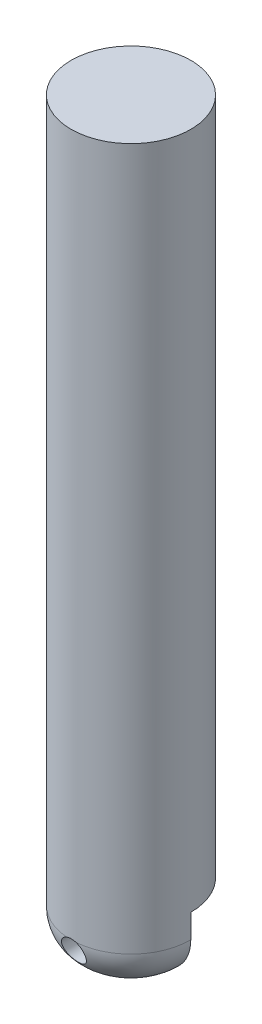
from build123d import *
from build123d.topology import SkipClean

# Parameters (mm, degrees)
SKETCH2_R           = 15
BOSS_EXTRUDE1_DEPTH = 170
BOSS_EXTRUDE2_START = 15.982197964
BOSS_EXTRUDE2_DEPTH = 15.982197964
SKETCH5_R           = 3
CUT_EXTRUDE1_DEPTH  = 19
FILLET5_R           = 10


with BuildPart() as part:
    # Sketch2 → Boss-Extrude1 (new body)
    with BuildSketch(Plane(origin=(0, 0, 0), x_dir=(1, 0, 0), z_dir=(0, 1, 0))):
        with Locations(Location((0, 0, 0), (0, 0, 270))):
            Circle(SKETCH2_R)
    extrude(amount=BOSS_EXTRUDE1_DEPTH)

    # Sketch3 → Boss-Extrude2 (add)
    with SkipClean():  # the faces are left unmerged after this step: merging them gives an invalid solid
        with BuildSketch(Plane.XZ.offset(BOSS_EXTRUDE2_START)):
            with BuildLine():
                Line((-15, 0), (15, 0))
                ThreePointArc((15, 0), (0, 15), (-15, 0))
            make_face()
        extrude(amount=-BOSS_EXTRUDE2_DEPTH)

    # Sketch5 → Cut-Extrude1 (cut)
    with SkipClean():  # the faces are left unmerged after this step: merging them gives an invalid solid
        with BuildSketch(Plane(origin=(0, 0, 0), x_dir=(-1, 0, 0), z_dir=(0, 0, -1))):
            with Locations((0, -8.732260388)):
                Circle(SKETCH5_R)
        extrude(amount=-CUT_EXTRUDE1_DEPTH, mode=Mode.SUBTRACT)

    # Fillet5
    # the kernel refuses this fillet: 10 mm, written as the material it takes off along each edge
    with BuildSketch(Plane(origin=(0, -15.982197964, 0), x_dir=(0.0031415874858799616, 0, -0.9999950652018581), z_dir=(-0.9999950652018581, 0, -0.0031415874858799616))) as fillet5_piece_1:
        with BuildLine():
            CenterArc((15 - FILLET5_R, -FILLET5_R), FILLET5_R, 0, 90)
            Line((15 - FILLET5_R, 0), (15, 0))
            Line((15, 0), (15, -FILLET5_R))
        make_face()
    revolve(axis=Axis((0, -15.982197964, 0), (0, -1, 0)), revolution_arc=359.64, mode=Mode.SUBTRACT)


solid = part.part
